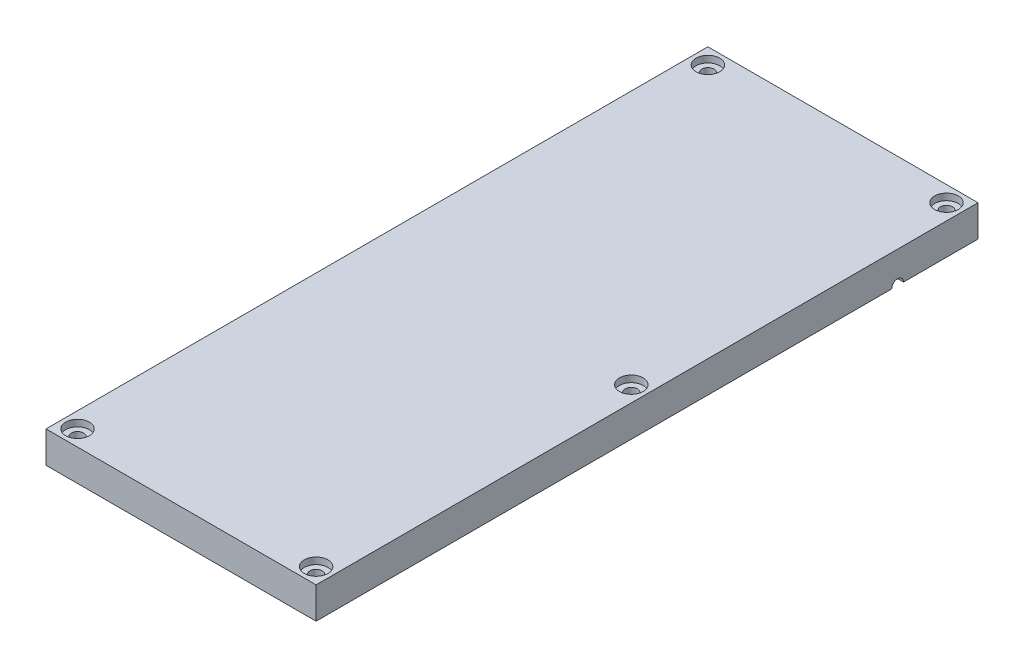
from build123d import *

# Parameters (mm, degrees)
BOSS_EXTRUDE1_START                                 = 12.7
SKETCH1_W                                           = 108.839
SKETCH1_H                                           = 266.7
BOSS_EXTRUDE1_DEPTH                                 = 12.7
CBORE_FOR_8_BINDING_HEAD_MACHINE_SCREW1_D           = 4.9149
CBORE_FOR_8_BINDING_HEAD_MACHINE_SCREW1_CBORE_D     = 9.525
CBORE_FOR_8_BINDING_HEAD_MACHINE_SCREW1_CBORE_DEPTH = 2.667
SKETCH4_W                                           = 71.374
SKETCH4_H                                           = 223.52
CUT_EXTRUDE1_DEPTH                                  = 9.525
SKETCH6_R                                           = 2.38125
SKETCH8_W                                           = 12.7
SKETCH8_H                                           = 12.7
CUT_EXTRUDE3_DEPTH                                  = 9.525


with BuildPart() as part:
    # Sketch1 → Boss-Extrude1 (new body)
    with BuildSketch(Plane(origin=(0, 0, 0), x_dir=(1, 0, 0), z_dir=(0, 1, 0)).offset(BOSS_EXTRUDE1_START)):
        with Locations((91.6305, 133.35)):
            Rectangle(SKETCH1_W, SKETCH1_H)
    extrude(amount=BOSS_EXTRUDE1_DEPTH)

    # CBORE for #8 Binding Head Machine Screw1 (through all)
    with Locations(Plane(origin=(0, 25.4, 0), x_dir=(1, 0, 0), z_dir=(0, 1, 0))):
        with Locations((139.7, 6.35), (139.7, 260.35), (43.561, 6.35), (43.561, 260.35), (139.7, 133.35)):
            CounterBoreHole(CBORE_FOR_8_BINDING_HEAD_MACHINE_SCREW1_D / 2, CBORE_FOR_8_BINDING_HEAD_MACHINE_SCREW1_CBORE_D / 2, CBORE_FOR_8_BINDING_HEAD_MACHINE_SCREW1_CBORE_DEPTH)

    # Sketch4 → Cut-Extrude1 (cut)
    with BuildSketch(Plane(origin=(0, 12.7, 0), x_dir=(-1, 0, 0), z_dir=(0, -1, 0))):
        with Locations((-79.248, 130.175)):
            Rectangle(SKETCH4_W, SKETCH4_H)
    extrude(amount=-CUT_EXTRUDE1_DEPTH, mode=Mode.SUBTRACT)

    # Cut-Sweep1: sweep along a path in Sketch5
    with BuildLine(Plane.XZ.offset(-12.7)) as cut_sweep1_path:
        Line((114.935, -196.215), (120.015, -196.215))
        Line((120.015, -196.215), (120.015, -234.315))
        Line((120.015, -234.315), (128.905, -234.315))
        Line((128.905, -234.315), (128.905, -158.115))
        Line((128.905, -158.115), (137.795, -158.115))
        Line((137.795, -158.115), (137.795, -234.315))
        Line((137.795, -234.315), (146.05, -234.315))
    # Sketch6 → Cut-Sweep1 (sweep, cut)
    with BuildSketch(Plane(origin=(146.05, 0, 0), x_dir=(0, 0, -1), z_dir=(1, 0, 0))):
        with Locations((234.315, 12.7)):
            Circle(SKETCH6_R)
    sweep(path=cut_sweep1_path.line, transition=Transition.RIGHT, mode=Mode.SUBTRACT)

    # Sketch8 → Cut-Extrude3 (cut)
    with BuildSketch(Plane.XZ.offset(-12.7)):
        with Locations((121.285, -24.765)):
            Rectangle(SKETCH8_W, SKETCH8_H)
        with Locations((108.585, -248.285)):
            Rectangle(SKETCH8_W, SKETCH8_H)
    extrude(amount=-CUT_EXTRUDE3_DEPTH, mode=Mode.SUBTRACT)


solid = part.part
